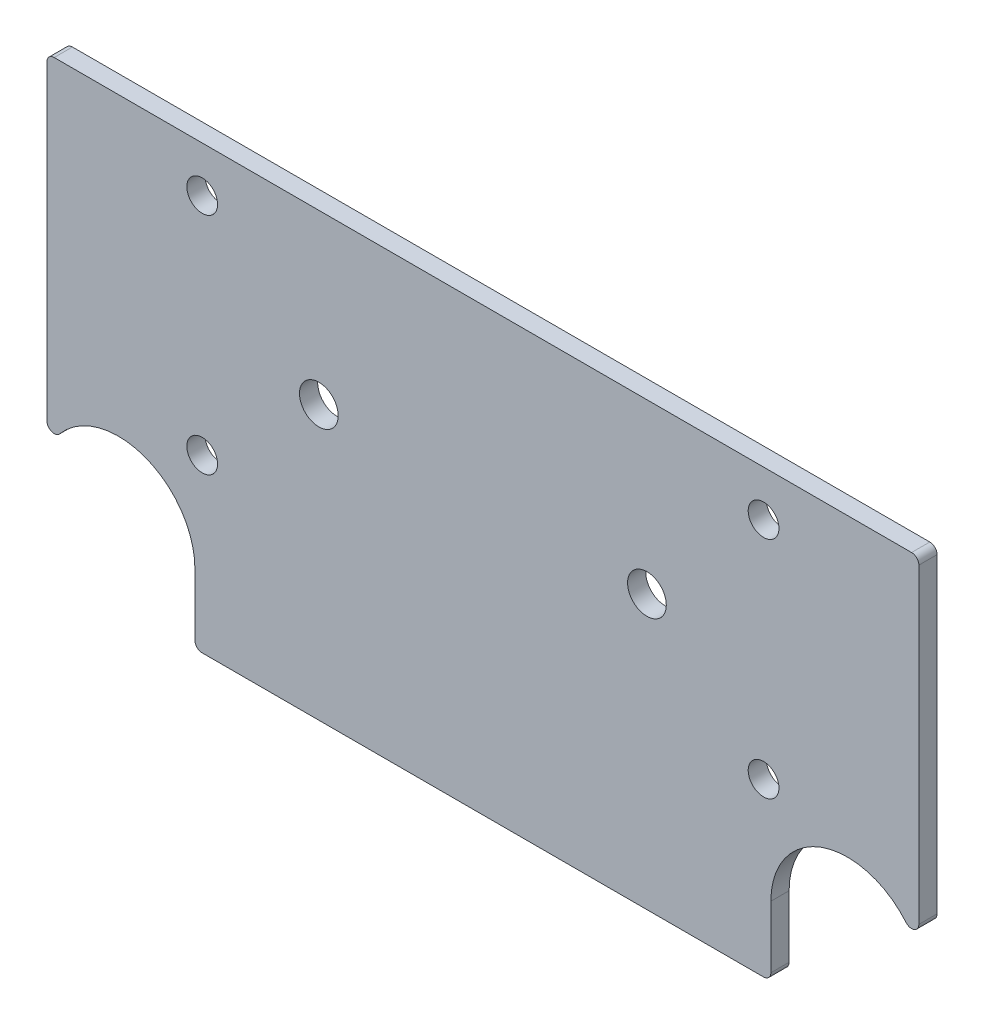
from build123d import *

# Parameters (mm, degrees)
BOSS_EXTRUDE1_DEPTH              = 6.35
CUT_EXTRUDE1_DEPTH               = 221.472033966
F_27_64_0_42188_DIAMETER_HOLE1_D = 10.715752
FILLET1_R                        = 2.54
F_1_2_CLEARANCE_HOLE1_D          = 13.49248


with BuildPart() as part:
    # Sketch1 → Boss-Extrude1 (new body)
    with BuildSketch(Plane.XY):
        with BuildLine():
            Line((-179.07, -25.4), (-179.07, 128.45828257))
            Line((-179.07, 128.45828257), (179.07, 128.45828257))
            Line((179.07, 128.45828257), (179.07, -25.4))
            Line((179.07, -25.4), (153.67, -25.4))
            Line((153.67, -25.4), (153.67, -1.27))
            ThreePointArc((153.67, -1.27), (127, 25.4), (100.33, -1.27))
            Line((100.33, -1.27), (100.33, -25.4))
            Line((100.33, -25.4), (-100.33, -25.4))
            Line((-100.33, -25.4), (-100.33, -1.27))
            ThreePointArc((-100.33, -1.27), (-127, 25.4), (-153.67, -1.27))
            Line((-153.67, -1.27), (-153.67, -25.4))
            Line((-153.67, -25.4), (-179.07, -25.4))
        make_face()
    extrude(amount=BOSS_EXTRUDE1_DEPTH)

    # Sketch7 → Cut-Extrude1 (cut, through all)
    with BuildSketch(Plane(origin=(0, 0, 0), x_dir=(-1, 0, 0), z_dir=(0, 0, -1))):
        with BuildLine():
            Line((-151.892, 128.45828257), (-151.892, 8.304823027))
            ThreePointArc((-151.892, 8.304823027), (-153.22173278, 3.599253536), (-153.67, -1.27))
            Line((-153.67, -1.27), (-153.67, -25.4))
            Line((-153.67, -25.4), (-179.07, -25.4))
            Line((-179.07, -25.4), (-179.07, 128.45828257))
            Line((-179.07, 128.45828257), (-151.892, 128.45828257))
        make_face()
        with BuildLine():
            Line((153.67, -25.4), (153.67, -1.27))
            ThreePointArc((153.67, -1.27), (153.22173278, 3.599253536), (151.892, 8.304823027))
            Line((151.892, 8.304823027), (151.892, 128.45828257))
            Line((151.892, 128.45828257), (179.07, 128.45828257))
            Line((179.07, 128.45828257), (179.07, -25.4))
            Line((179.07, -25.4), (153.67, -25.4))
        make_face()
    extrude(amount=-CUT_EXTRUDE1_DEPTH, mode=Mode.SUBTRACT)

    # 27/64 (0.42188) Diameter Hole1 (through all)
    with Locations(Plane.XY.offset(6.35)):
        with Locations((-97.79, 34.29), (-97.79, 112.58328257), (97.79, 34.29), (97.79, 112.58328257)):
            Hole(F_27_64_0_42188_DIAMETER_HOLE1_D / 2)

    # Fillet1
    fillet1_edges = [part.edges().sort_by_distance(p)[0] for p in [
        (100.33, -25.4, 3.175),
        (-100.33, -25.4, 3.175),
        (-151.892, 8.304823027, 3.175),
        (-151.892, 128.45828257, 3.175),
        (151.892, 128.45828257, 3.175),
        (151.892, 8.304823027, 3.175),
    ]]
    fillet(fillet1_edges, radius=FILLET1_R)

    # 1/2 Clearance Hole1 (through all)
    with Locations(Plane.XY.offset(6.35)):
        with Locations((57.15, 69.85), (-57.15, 69.85)):
            Hole(F_1_2_CLEARANCE_HOLE1_D / 2)


solid = part.part
